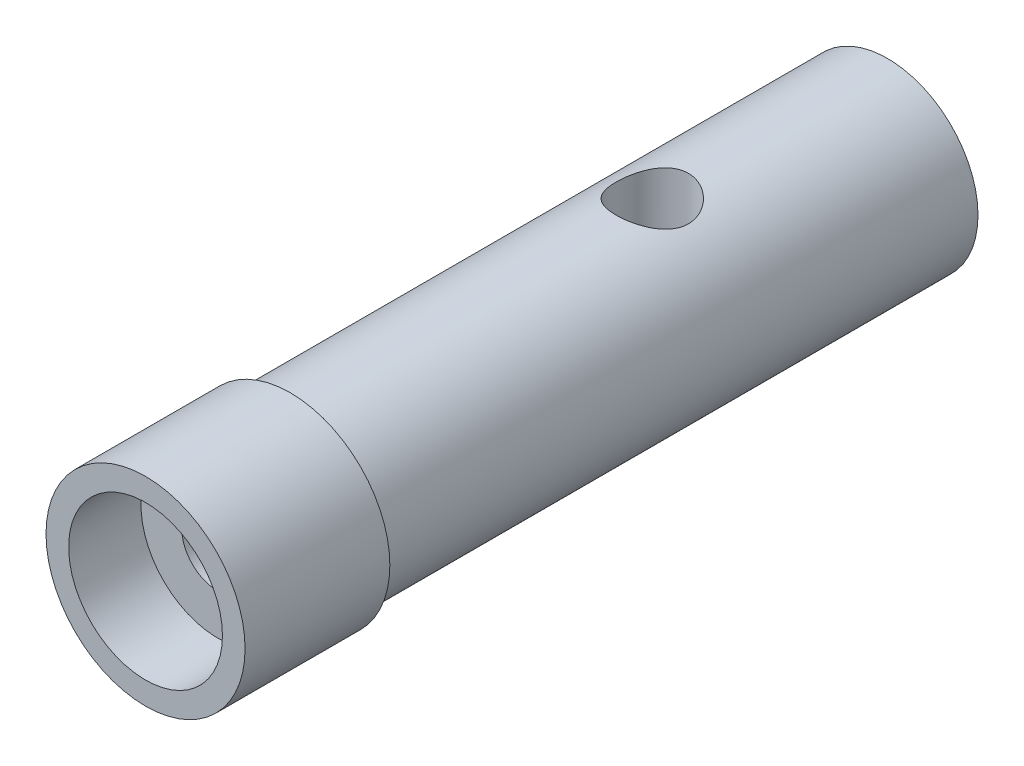
from build123d import *

# Parameters (mm, degrees)
SKETCH1_W                                          = 5.5
SKETCH1_H                                          = 8
SKETCH2_R                                          = 5
BOSS_EXTRUDE1_DEPTH                                = 33
CBORE_FOR_M3_5_HEX_HEAD_MACHINE_SCREW1_D           = 4
CBORE_FOR_M3_5_HEX_HEAD_MACHINE_SCREW1_DEPTH       = 14
CBORE_FOR_M3_5_HEX_HEAD_MACHINE_SCREW1_CBORE_D     = 8.5
CBORE_FOR_M3_5_HEX_HEAD_MACHINE_SCREW1_CBORE_DEPTH = 4
HOLE1_REACH                                        = 38.626
HOLE1_BORE_R                                       = 1
SKETCH6_R                                          = 2
CUT_EXTRUDE1_DEPTH                                 = 10
SKETCH7_R                                          = 2
CUT_EXTRUDE2_DEPTH                                 = 5


with BuildPart() as part:
    # Sketch1 → Revolve1 (revolve)
    with BuildSketch(Plane(origin=(0, 0, 0), x_dir=(1, 0, 0), z_dir=(0, 1, 0))):
        with Locations((2.75, -4)):
            Rectangle(SKETCH1_W, SKETCH1_H)
    revolve(axis=Axis((0, 0, 0), (0, 0, 1)))

    # Sketch2 → Boss-Extrude1 (add)
    with BuildSketch(Plane(origin=(0, 0, 0), x_dir=(-1, 0, 0), z_dir=(0, 0, -1))):
        Circle(SKETCH2_R)
    extrude(amount=BOSS_EXTRUDE1_DEPTH)

    # CBORE for M3.5 Hex Head Machine Screw1
    with Locations(Plane.XY.offset(8)):
        with Locations((0, 0)):
            CounterBoreHole(CBORE_FOR_M3_5_HEX_HEAD_MACHINE_SCREW1_D / 2, CBORE_FOR_M3_5_HEX_HEAD_MACHINE_SCREW1_CBORE_D / 2, CBORE_FOR_M3_5_HEX_HEAD_MACHINE_SCREW1_CBORE_DEPTH, depth=CBORE_FOR_M3_5_HEX_HEAD_MACHINE_SCREW1_DEPTH)

    # Hole1 bore (on position points) → Hole1 (cut, up to next)
    with BuildSketch(Plane(origin=(-5.5, 0, 1.5), x_dir=(0, -1, 0), z_dir=(-1, 0, 0)), mode=Mode.PRIVATE) as hole1_sk1:
        Circle(HOLE1_BORE_R)
    hole1_tool1 = extrude(hole1_sk1.sketch, amount=-HOLE1_REACH, mode=Mode.PRIVATE) & part.part
    add(hole1_tool1.solids().sort_by_distance((-5.5, 0, 1.5))[0], mode=Mode.SUBTRACT)

    # Sketch6 → Cut-Extrude1 (cut)
    with BuildSketch(Plane(origin=(0, 0, -33), x_dir=(-1, 0, 0), z_dir=(0, 0, -1))):
        Circle(SKETCH6_R)
    extrude(amount=-CUT_EXTRUDE1_DEPTH, mode=Mode.SUBTRACT)

    # Sketch7 → Cut-Extrude2 (cut)
    with BuildSketch(Plane(origin=(0, 5, 0), x_dir=(1, 0, 0), z_dir=(0, 1, 0))):
        with Locations((0, 20)):
            Circle(SKETCH7_R)
    extrude(amount=-CUT_EXTRUDE2_DEPTH, mode=Mode.SUBTRACT)


solid = part.part
